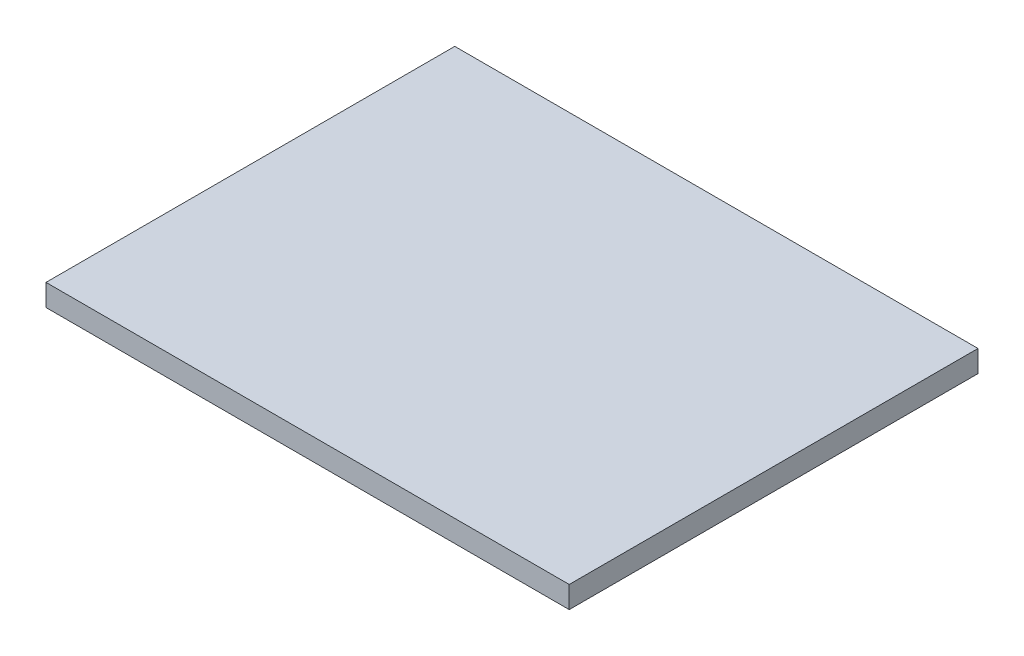
from build123d import *

# Parameters (mm, degrees)
SKETCH1_W           = 96
SKETCH1_H           = 75
BOSS_EXTRUDE1_DEPTH = 4


with BuildPart() as part:
    # Sketch1 → Boss-Extrude1 (new body)
    with BuildSketch(Plane(origin=(0, -8, 0), x_dir=(-1, 0, 0), z_dir=(0, -1, 0))):
        with Locations((-50, 37.5)):
            Rectangle(SKETCH1_W, SKETCH1_H)
    extrude(amount=-BOSS_EXTRUDE1_DEPTH)


solid = part.part
